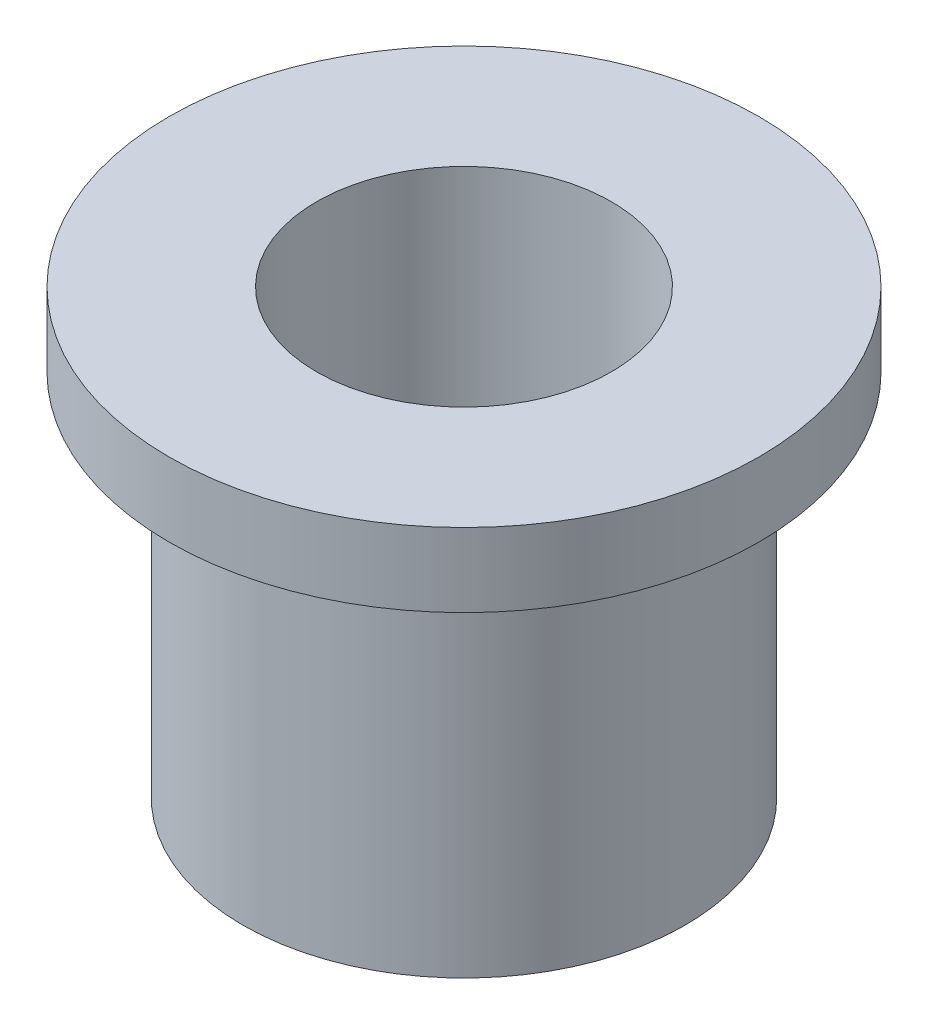
from build123d import *


with BuildPart() as part:
    # Sketch1 → Revolve1 (revolve)
    with BuildSketch(Plane.XY):
        Polygon((3.175, 0), (3.175, -9.525), (4.7625, -9.525), (4.7625, -1.5875), (6.35, -1.5875), (6.35, 0), align=None)
    revolve(axis=Axis((0, 0, 0), (0, -1, 0)))


solid = part.part
